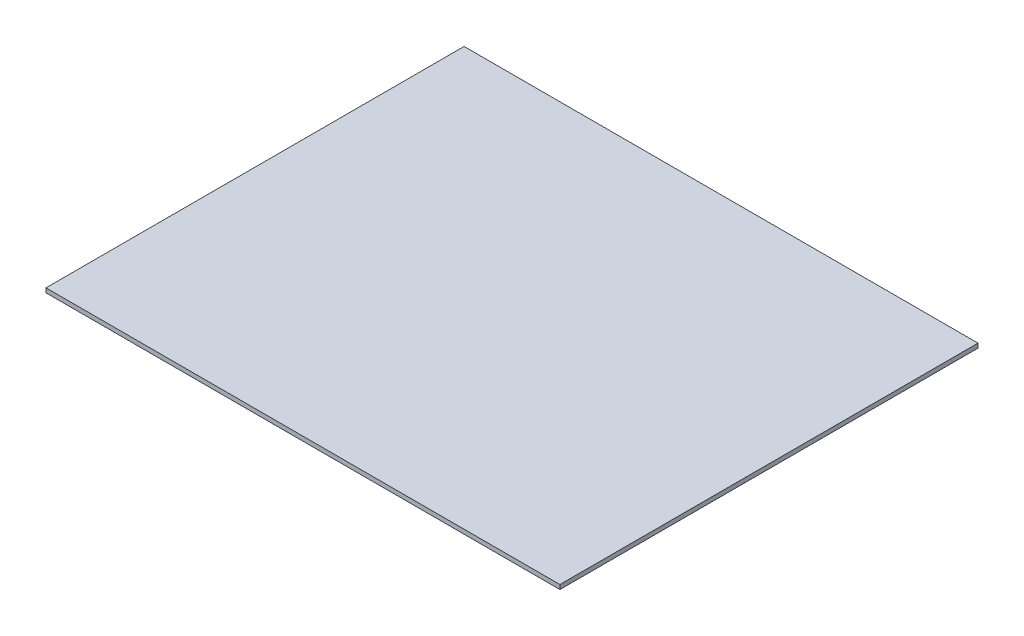
from build123d import *

# Parameters (mm, degrees)
SKETCH1_W           = 374.65
SKETCH1_H           = 304.8
BOSS_EXTRUDE1_DEPTH = 3.175


with BuildPart() as part:
    # Sketch1 → Boss-Extrude1 (new body)
    with BuildSketch(Plane(origin=(0, 0, 0), x_dir=(1, 0, 0), z_dir=(0, 1, 0))):
        Rectangle(SKETCH1_W, SKETCH1_H)
    extrude(amount=BOSS_EXTRUDE1_DEPTH)


solid = part.part
